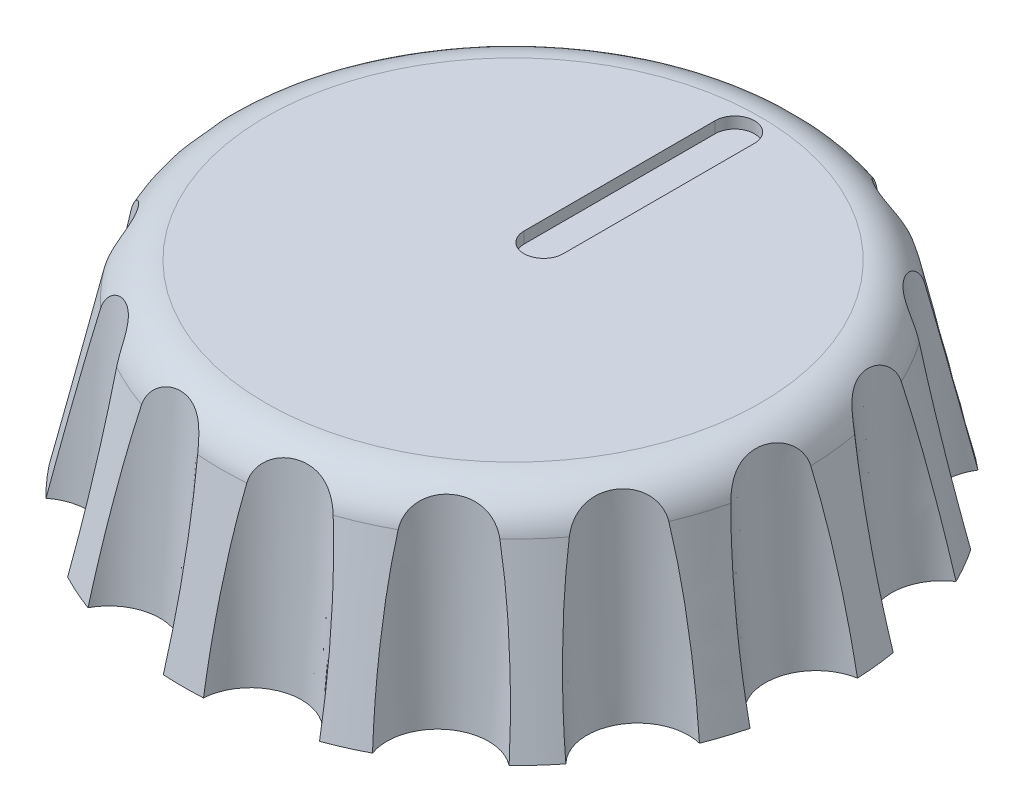
from build123d import *

# Parameters (mm, degrees)
SKETCH1_R                     = 15
BOSS_EXTRUDE1_DEPTH           = 11
SKETCH2_R                     = 2.95
CUT_EXTRUDE1_DEPTH            = 9.8
CUT_EXTRUDE2_DEPTH            = 9.8
CHAMFER1_SIZE                 = 11
CHAMFER1_SIZE_2               = 2.5
FILLET1_R                     = 2
CUT_EXTRUDE6_DEPTH            = 0.5
SKETCH4_R                     = 2.1
CUT_EXTRUDE7_DEPTH            = 11
CUT_EXTRUDE7_DRAFT            = -4
CUT_EXTRUDE7_PROFILE_2_DEPTH  = 11
CUT_EXTRUDE7_PROFILE_2_DRAFT  = -4
CUT_EXTRUDE7_PROFILE_3_DEPTH  = 11
CUT_EXTRUDE7_PROFILE_3_DRAFT  = -4
CUT_EXTRUDE7_PROFILE_4_DEPTH  = 11
CUT_EXTRUDE7_PROFILE_4_DRAFT  = -4
CUT_EXTRUDE7_PROFILE_5_DEPTH  = 11
CUT_EXTRUDE7_PROFILE_5_DRAFT  = -4
CUT_EXTRUDE7_PROFILE_6_DEPTH  = 11
CUT_EXTRUDE7_PROFILE_6_DRAFT  = -4
CUT_EXTRUDE7_PROFILE_7_DEPTH  = 11
CUT_EXTRUDE7_PROFILE_7_DRAFT  = -4
CUT_EXTRUDE7_PROFILE_8_DEPTH  = 11
CUT_EXTRUDE7_PROFILE_8_DRAFT  = -4
CUT_EXTRUDE7_PROFILE_9_DEPTH  = 11
CUT_EXTRUDE7_PROFILE_9_DRAFT  = -4
CUT_EXTRUDE7_PROFILE_10_DEPTH = 11
CUT_EXTRUDE7_PROFILE_10_DRAFT = -4
CUT_EXTRUDE7_PROFILE_11_DEPTH = 11
CUT_EXTRUDE7_PROFILE_11_DRAFT = -4
CUT_EXTRUDE7_PROFILE_12_DEPTH = 11
CUT_EXTRUDE7_PROFILE_12_DRAFT = -4
CUT_EXTRUDE7_PROFILE_13_DEPTH = 11
CUT_EXTRUDE7_PROFILE_13_DRAFT = -4
CUT_EXTRUDE7_PROFILE_14_DEPTH = 11
CUT_EXTRUDE7_PROFILE_14_DRAFT = -4
CUT_EXTRUDE7_PROFILE_15_DEPTH = 11
CUT_EXTRUDE7_PROFILE_15_DRAFT = -4
SKETCH6_W                     = 45.954277426
SKETCH6_H                     = 33.568292674
CUT_EXTRUDE8_DEPTH            = 2


with BuildPart() as part:
    # Sketch1 → Boss-Extrude1 (new body)
    with BuildSketch(Plane(origin=(0, 0, 0), x_dir=(1, 0, 0), z_dir=(0, 1, 0))):
        with Locations(Location((0, 0, 0), (0, 0, 270))):
            Circle(SKETCH1_R)
    extrude(amount=BOSS_EXTRUDE1_DEPTH)

    # Sketch2 → Cut-Extrude1 (cut)
    with BuildSketch(Plane.XZ):
        with Locations(Location((0, 0, 0), (0, 0, 270))):
            Circle(SKETCH2_R)
    extrude(amount=-CUT_EXTRUDE1_DEPTH, mode=Mode.SUBTRACT)

    # Sketch3 → Cut-Extrude2 (cut)
    with BuildSketch(Plane(origin=(0, 0, 0), x_dir=(1, 0, 0), z_dir=(0, 1, 0))):
        Polygon((0.5, 2.883677317), (-0.5, 2.883677317), (0, 3.383677317), align=None)
        Polygon((1.45612204, 2.538760223), (0.516429419, 2.880780367), (1.157285801, 3.179616606), align=None)
        Polygon((2.236614271, 1.887631179), (1.470569828, 2.530418789), (2.174985854, 2.592047206), align=None)
        Polygon((2.747337812, 1.008825956), (2.247337812, 1.87485136), (2.930350514, 1.691838658), align=None)
        Polygon((2.926691867, 0.008341434), (2.75304369, 0.993149188), (3.332271655, 0.5875694), align=None)
        Polygon((2.75304369, -0.993149188), (2.926691867, -0.008341435), (3.332271655, -0.5875694), align=None)
        Polygon((2.247337812, -1.87485136), (2.747337812, -1.008825956), (2.930350514, -1.691838658), align=None)
        Polygon((1.470569828, -2.530418789), (2.236614271, -1.887631179), (2.174985854, -2.592047206), align=None)
        Polygon((0.516429419, -2.880780367), (1.45612204, -2.538760223), (1.157285801, -3.179616606), align=None)
        Polygon((-0.5, -2.883677317), (0.5, -2.883677317), (0, -3.383677317), align=None)
        Polygon((-1.45612204, -2.538760223), (-0.516429419, -2.880780367), (-1.157285801, -3.179616606), align=None)
        Polygon((-2.236614271, -1.887631179), (-1.470569828, -2.530418789), (-2.174985854, -2.592047206), align=None)
        Polygon((-2.747337812, -1.008825956), (-2.247337812, -1.87485136), (-2.930350514, -1.691838658), align=None)
        Polygon((-2.926691867, -0.008341434), (-2.75304369, -0.993149188), (-3.332271655, -0.5875694), align=None)
        Polygon((-2.75304369, 0.993149188), (-2.926691867, 0.008341435), (-3.332271655, 0.5875694), align=None)
        Polygon((-2.247337812, 1.87485136), (-2.747337812, 1.008825956), (-2.930350514, 1.691838658), align=None)
        Polygon((-1.470569828, 2.530418789), (-2.236614271, 1.887631179), (-2.174985854, 2.592047206), align=None)
        Polygon((-0.516429419, 2.880780367), (-1.45612204, 2.538760223), (-1.157285801, 3.179616606), align=None)
    extrude(amount=CUT_EXTRUDE2_DEPTH, mode=Mode.SUBTRACT)

    # Chamfer1
    # the kernel refuses this chamfer: 11, 2.5 mm, written as the material it takes off along each edge
    with BuildSketch(Plane(origin=(0, 11, 0), x_dir=(0, 0, 1), z_dir=(-1, 0, 0))) as chamfer1_piece_1:
        Polygon((15, -CHAMFER1_SIZE), (15 - CHAMFER1_SIZE_2, 0), (15, 0), align=None)
    revolve(axis=Axis((0, 11, 0), (0, 1, 0)), mode=Mode.SUBTRACT)

    # Fillet1
    fillet1_edges = [part.edges().sort_by_distance(p)[0] for p in [
        (0, 11, -12.5),
    ]]
    fillet(fillet1_edges, radius=FILLET1_R)

    # Sketch5 → Cut-Extrude6 (cut)
    with BuildSketch(Plane(origin=(0, 11, 0), x_dir=(1, 0, 0), z_dir=(0, 1, 0))):
        with BuildLine():
            Line((-0.865286108, 1.346377454), (-0.865286108, 9.765172822))
            ThreePointArc((-0.865286108, 9.765172822), (0, 10.63045893), (0.865286108, 9.765172822))
            Line((0.865286108, 9.765172822), (0.865286108, 1.346377454))
            ThreePointArc((0.865286108, 1.346377454), (0, 0.481091346), (-0.865286108, 1.346377454))
        make_face()
    extrude(amount=-CUT_EXTRUDE6_DEPTH, mode=Mode.SUBTRACT)


with BuildPart() as cut_extrude7_tool:
    # Sketch4 → Cut-Extrude7 (with draft: the straight prism first)
    with BuildSketch(Plane(origin=(0, 0, 0), x_dir=(1, 0, 0), z_dir=(0, 1, 0))):
        with Locations((0, 15)):
            Circle(SKETCH4_R)
    extrude(amount=CUT_EXTRUDE7_DEPTH)
    # Cut-Extrude7: the draft: its side faces are tilted about the plane it starts from
    cut_extrude7_sides = [cut_extrude7_tool.faces().sort_by_distance(p)[0] for p in [
        (-2.1, 5.5, -15),
    ]]
    draft(cut_extrude7_sides, Plane(origin=(0, 0, 0), x_dir=(1, 0, 0), z_dir=(0, 1, 0)), CUT_EXTRUDE7_DRAFT)


with BuildPart() as part_1:
    add(part.part)

    # Cut-Extrude7: cut by cut_extrude7_tool
    add(cut_extrude7_tool.part, mode=Mode.SUBTRACT)


with BuildPart() as cut_extrude7_profile_2_tool:
    # Sketch4 → Cut-Extrude7 profile 2 (with draft: the straight prism first)
    with BuildSketch(Plane(origin=(0, 0, 0), x_dir=(1, 0, 0), z_dir=(0, 1, 0))):
        with Locations((6.101049646, 13.703181865)):
            Circle(SKETCH4_R)
    extrude(amount=CUT_EXTRUDE7_PROFILE_2_DEPTH)
    # Cut-Extrude7 profile 2: the draft: its side faces are tilted about the plane it starts from
    cut_extrude7_profile_2_sides = [cut_extrude7_profile_2_tool.faces().sort_by_distance(p)[0] for p in [
        (4.001049646, 5.5, -13.703181865),
    ]]
    draft(cut_extrude7_profile_2_sides, Plane(origin=(0, 0, 0), x_dir=(1, 0, 0), z_dir=(0, 1, 0)), CUT_EXTRUDE7_PROFILE_2_DRAFT)


with BuildPart() as part_2:
    add(part_1.part)

    # Cut-Extrude7 profile 2: cut by cut_extrude7_profile_2_tool
    add(cut_extrude7_profile_2_tool.part, mode=Mode.SUBTRACT)


with BuildPart() as cut_extrude7_profile_3_tool:
    # Sketch4 → Cut-Extrude7 profile 3 (with draft: the straight prism first)
    with BuildSketch(Plane(origin=(0, 0, 0), x_dir=(1, 0, 0), z_dir=(0, 1, 0))):
        with Locations((11.147172382, 10.036959095)):
            Circle(SKETCH4_R)
    extrude(amount=CUT_EXTRUDE7_PROFILE_3_DEPTH)
    # Cut-Extrude7 profile 3: the draft: its side faces are tilted about the plane it starts from
    cut_extrude7_profile_3_sides = [cut_extrude7_profile_3_tool.faces().sort_by_distance(p)[0] for p in [
        (9.047172382, 5.5, -10.036959095),
    ]]
    draft(cut_extrude7_profile_3_sides, Plane(origin=(0, 0, 0), x_dir=(1, 0, 0), z_dir=(0, 1, 0)), CUT_EXTRUDE7_PROFILE_3_DRAFT)


with BuildPart() as part_3:
    add(part_2.part)

    # Cut-Extrude7 profile 3: cut by cut_extrude7_profile_3_tool
    add(cut_extrude7_profile_3_tool.part, mode=Mode.SUBTRACT)


with BuildPart() as cut_extrude7_profile_4_tool:
    # Sketch4 → Cut-Extrude7 profile 4 (with draft: the straight prism first)
    with BuildSketch(Plane(origin=(0, 0, 0), x_dir=(1, 0, 0), z_dir=(0, 1, 0))):
        with Locations((14.265847744, 4.635254916)):
            Circle(SKETCH4_R)
    extrude(amount=CUT_EXTRUDE7_PROFILE_4_DEPTH)
    # Cut-Extrude7 profile 4: the draft: its side faces are tilted about the plane it starts from
    cut_extrude7_profile_4_sides = [cut_extrude7_profile_4_tool.faces().sort_by_distance(p)[0] for p in [
        (12.165847744, 5.5, -4.635254916),
    ]]
    draft(cut_extrude7_profile_4_sides, Plane(origin=(0, 0, 0), x_dir=(1, 0, 0), z_dir=(0, 1, 0)), CUT_EXTRUDE7_PROFILE_4_DRAFT)


with BuildPart() as part_4:
    add(part_3.part)

    # Cut-Extrude7 profile 4: cut by cut_extrude7_profile_4_tool
    add(cut_extrude7_profile_4_tool.part, mode=Mode.SUBTRACT)


with BuildPart() as cut_extrude7_profile_5_tool:
    # Sketch4 → Cut-Extrude7 profile 5 (with draft: the straight prism first)
    with BuildSketch(Plane(origin=(0, 0, 0), x_dir=(1, 0, 0), z_dir=(0, 1, 0))):
        with Locations((14.917828431, -1.567926949)):
            Circle(SKETCH4_R)
    extrude(amount=CUT_EXTRUDE7_PROFILE_5_DEPTH)
    # Cut-Extrude7 profile 5: the draft: its side faces are tilted about the plane it starts from
    cut_extrude7_profile_5_sides = [cut_extrude7_profile_5_tool.faces().sort_by_distance(p)[0] for p in [
        (12.817828431, 5.5, 1.567926949),
    ]]
    draft(cut_extrude7_profile_5_sides, Plane(origin=(0, 0, 0), x_dir=(1, 0, 0), z_dir=(0, 1, 0)), CUT_EXTRUDE7_PROFILE_5_DRAFT)


with BuildPart() as part_5:
    add(part_4.part)

    # Cut-Extrude7 profile 5: cut by cut_extrude7_profile_5_tool
    add(cut_extrude7_profile_5_tool.part, mode=Mode.SUBTRACT)


with BuildPart() as cut_extrude7_profile_6_tool:
    # Sketch4 → Cut-Extrude7 profile 6 (with draft: the straight prism first)
    with BuildSketch(Plane(origin=(0, 0, 0), x_dir=(1, 0, 0), z_dir=(0, 1, 0))):
        with Locations((12.990381057, -7.5)):
            Circle(SKETCH4_R)
    extrude(amount=CUT_EXTRUDE7_PROFILE_6_DEPTH)
    # Cut-Extrude7 profile 6: the draft: its side faces are tilted about the plane it starts from
    cut_extrude7_profile_6_sides = [cut_extrude7_profile_6_tool.faces().sort_by_distance(p)[0] for p in [
        (10.890381057, 5.5, 7.5),
    ]]
    draft(cut_extrude7_profile_6_sides, Plane(origin=(0, 0, 0), x_dir=(1, 0, 0), z_dir=(0, 1, 0)), CUT_EXTRUDE7_PROFILE_6_DRAFT)


with BuildPart() as part_6:
    add(part_5.part)

    # Cut-Extrude7 profile 6: cut by cut_extrude7_profile_6_tool
    add(cut_extrude7_profile_6_tool.part, mode=Mode.SUBTRACT)


with BuildPart() as cut_extrude7_profile_7_tool:
    # Sketch4 → Cut-Extrude7 profile 7 (with draft: the straight prism first)
    with BuildSketch(Plane(origin=(0, 0, 0), x_dir=(1, 0, 0), z_dir=(0, 1, 0))):
        with Locations((8.816778784, -12.135254916)):
            Circle(SKETCH4_R)
    extrude(amount=CUT_EXTRUDE7_PROFILE_7_DEPTH)
    # Cut-Extrude7 profile 7: the draft: its side faces are tilted about the plane it starts from
    cut_extrude7_profile_7_sides = [cut_extrude7_profile_7_tool.faces().sort_by_distance(p)[0] for p in [
        (6.716778784, 5.5, 12.135254916),
    ]]
    draft(cut_extrude7_profile_7_sides, Plane(origin=(0, 0, 0), x_dir=(1, 0, 0), z_dir=(0, 1, 0)), CUT_EXTRUDE7_PROFILE_7_DRAFT)


with BuildPart() as part_7:
    add(part_6.part)

    # Cut-Extrude7 profile 7: cut by cut_extrude7_profile_7_tool
    add(cut_extrude7_profile_7_tool.part, mode=Mode.SUBTRACT)


with BuildPart() as cut_extrude7_profile_8_tool:
    # Sketch4 → Cut-Extrude7 profile 8 (with draft: the straight prism first)
    with BuildSketch(Plane(origin=(0, 0, 0), x_dir=(1, 0, 0), z_dir=(0, 1, 0))):
        with Locations((3.118675362, -14.672214011)):
            Circle(SKETCH4_R)
    extrude(amount=CUT_EXTRUDE7_PROFILE_8_DEPTH)
    # Cut-Extrude7 profile 8: the draft: its side faces are tilted about the plane it starts from
    cut_extrude7_profile_8_sides = [cut_extrude7_profile_8_tool.faces().sort_by_distance(p)[0] for p in [
        (1.018675362, 5.5, 14.672214011),
    ]]
    draft(cut_extrude7_profile_8_sides, Plane(origin=(0, 0, 0), x_dir=(1, 0, 0), z_dir=(0, 1, 0)), CUT_EXTRUDE7_PROFILE_8_DRAFT)


with BuildPart() as part_8:
    add(part_7.part)

    # Cut-Extrude7 profile 8: cut by cut_extrude7_profile_8_tool
    add(cut_extrude7_profile_8_tool.part, mode=Mode.SUBTRACT)


with BuildPart() as cut_extrude7_profile_9_tool:
    # Sketch4 → Cut-Extrude7 profile 9 (with draft: the straight prism first)
    with BuildSketch(Plane(origin=(0, 0, 0), x_dir=(1, 0, 0), z_dir=(0, 1, 0))):
        with Locations((-3.118675362, -14.672214011)):
            Circle(SKETCH4_R)
    extrude(amount=CUT_EXTRUDE7_PROFILE_9_DEPTH)
    # Cut-Extrude7 profile 9: the draft: its side faces are tilted about the plane it starts from
    cut_extrude7_profile_9_sides = [cut_extrude7_profile_9_tool.faces().sort_by_distance(p)[0] for p in [
        (-5.218675362, 5.5, 14.672214011),
    ]]
    draft(cut_extrude7_profile_9_sides, Plane(origin=(0, 0, 0), x_dir=(1, 0, 0), z_dir=(0, 1, 0)), CUT_EXTRUDE7_PROFILE_9_DRAFT)


with BuildPart() as part_9:
    add(part_8.part)

    # Cut-Extrude7 profile 9: cut by cut_extrude7_profile_9_tool
    add(cut_extrude7_profile_9_tool.part, mode=Mode.SUBTRACT)


with BuildPart() as cut_extrude7_profile_10_tool:
    # Sketch4 → Cut-Extrude7 profile 10 (with draft: the straight prism first)
    with BuildSketch(Plane(origin=(0, 0, 0), x_dir=(1, 0, 0), z_dir=(0, 1, 0))):
        with Locations((-8.816778784, -12.135254916)):
            Circle(SKETCH4_R)
    extrude(amount=CUT_EXTRUDE7_PROFILE_10_DEPTH)
    # Cut-Extrude7 profile 10: the draft: its side faces are tilted about the plane it starts from
    cut_extrude7_profile_10_sides = [cut_extrude7_profile_10_tool.faces().sort_by_distance(p)[0] for p in [
        (-10.916778784, 5.5, 12.135254916),
    ]]
    draft(cut_extrude7_profile_10_sides, Plane(origin=(0, 0, 0), x_dir=(1, 0, 0), z_dir=(0, 1, 0)), CUT_EXTRUDE7_PROFILE_10_DRAFT)


with BuildPart() as part_10:
    add(part_9.part)

    # Cut-Extrude7 profile 10: cut by cut_extrude7_profile_10_tool
    add(cut_extrude7_profile_10_tool.part, mode=Mode.SUBTRACT)


with BuildPart() as cut_extrude7_profile_11_tool:
    # Sketch4 → Cut-Extrude7 profile 11 (with draft: the straight prism first)
    with BuildSketch(Plane(origin=(0, 0, 0), x_dir=(1, 0, 0), z_dir=(0, 1, 0))):
        with Locations((-12.990381057, -7.5)):
            Circle(SKETCH4_R)
    extrude(amount=CUT_EXTRUDE7_PROFILE_11_DEPTH)
    # Cut-Extrude7 profile 11: the draft: its side faces are tilted about the plane it starts from
    cut_extrude7_profile_11_sides = [cut_extrude7_profile_11_tool.faces().sort_by_distance(p)[0] for p in [
        (-15.090381057, 5.5, 7.5),
    ]]
    draft(cut_extrude7_profile_11_sides, Plane(origin=(0, 0, 0), x_dir=(1, 0, 0), z_dir=(0, 1, 0)), CUT_EXTRUDE7_PROFILE_11_DRAFT)


with BuildPart() as part_11:
    add(part_10.part)

    # Cut-Extrude7 profile 11: cut by cut_extrude7_profile_11_tool
    add(cut_extrude7_profile_11_tool.part, mode=Mode.SUBTRACT)


with BuildPart() as cut_extrude7_profile_12_tool:
    # Sketch4 → Cut-Extrude7 profile 12 (with draft: the straight prism first)
    with BuildSketch(Plane(origin=(0, 0, 0), x_dir=(1, 0, 0), z_dir=(0, 1, 0))):
        with Locations((-14.917828431, -1.567926949)):
            Circle(SKETCH4_R)
    extrude(amount=CUT_EXTRUDE7_PROFILE_12_DEPTH)
    # Cut-Extrude7 profile 12: the draft: its side faces are tilted about the plane it starts from
    cut_extrude7_profile_12_sides = [cut_extrude7_profile_12_tool.faces().sort_by_distance(p)[0] for p in [
        (-17.017828431, 5.5, 1.567926949),
    ]]
    draft(cut_extrude7_profile_12_sides, Plane(origin=(0, 0, 0), x_dir=(1, 0, 0), z_dir=(0, 1, 0)), CUT_EXTRUDE7_PROFILE_12_DRAFT)


with BuildPart() as part_12:
    add(part_11.part)

    # Cut-Extrude7 profile 12: cut by cut_extrude7_profile_12_tool
    add(cut_extrude7_profile_12_tool.part, mode=Mode.SUBTRACT)


with BuildPart() as cut_extrude7_profile_13_tool:
    # Sketch4 → Cut-Extrude7 profile 13 (with draft: the straight prism first)
    with BuildSketch(Plane(origin=(0, 0, 0), x_dir=(1, 0, 0), z_dir=(0, 1, 0))):
        with Locations((-14.265847744, 4.635254916)):
            Circle(SKETCH4_R)
    extrude(amount=CUT_EXTRUDE7_PROFILE_13_DEPTH)
    # Cut-Extrude7 profile 13: the draft: its side faces are tilted about the plane it starts from
    cut_extrude7_profile_13_sides = [cut_extrude7_profile_13_tool.faces().sort_by_distance(p)[0] for p in [
        (-16.365847744, 5.5, -4.635254916),
    ]]
    draft(cut_extrude7_profile_13_sides, Plane(origin=(0, 0, 0), x_dir=(1, 0, 0), z_dir=(0, 1, 0)), CUT_EXTRUDE7_PROFILE_13_DRAFT)


with BuildPart() as part_13:
    add(part_12.part)

    # Cut-Extrude7 profile 13: cut by cut_extrude7_profile_13_tool
    add(cut_extrude7_profile_13_tool.part, mode=Mode.SUBTRACT)


with BuildPart() as cut_extrude7_profile_14_tool:
    # Sketch4 → Cut-Extrude7 profile 14 (with draft: the straight prism first)
    with BuildSketch(Plane(origin=(0, 0, 0), x_dir=(1, 0, 0), z_dir=(0, 1, 0))):
        with Locations((-11.147172382, 10.036959095)):
            Circle(SKETCH4_R)
    extrude(amount=CUT_EXTRUDE7_PROFILE_14_DEPTH)
    # Cut-Extrude7 profile 14: the draft: its side faces are tilted about the plane it starts from
    cut_extrude7_profile_14_sides = [cut_extrude7_profile_14_tool.faces().sort_by_distance(p)[0] for p in [
        (-13.247172382, 5.5, -10.036959095),
    ]]
    draft(cut_extrude7_profile_14_sides, Plane(origin=(0, 0, 0), x_dir=(1, 0, 0), z_dir=(0, 1, 0)), CUT_EXTRUDE7_PROFILE_14_DRAFT)


with BuildPart() as part_14:
    add(part_13.part)

    # Cut-Extrude7 profile 14: cut by cut_extrude7_profile_14_tool
    add(cut_extrude7_profile_14_tool.part, mode=Mode.SUBTRACT)


with BuildPart() as cut_extrude7_profile_15_tool:
    # Sketch4 → Cut-Extrude7 profile 15 (with draft: the straight prism first)
    with BuildSketch(Plane(origin=(0, 0, 0), x_dir=(1, 0, 0), z_dir=(0, 1, 0))):
        with Locations((-6.101049646, 13.703181865)):
            Circle(SKETCH4_R)
    extrude(amount=CUT_EXTRUDE7_PROFILE_15_DEPTH)
    # Cut-Extrude7 profile 15: the draft: its side faces are tilted about the plane it starts from
    cut_extrude7_profile_15_sides = [cut_extrude7_profile_15_tool.faces().sort_by_distance(p)[0] for p in [
        (-8.201049646, 5.5, -13.703181865),
    ]]
    draft(cut_extrude7_profile_15_sides, Plane(origin=(0, 0, 0), x_dir=(1, 0, 0), z_dir=(0, 1, 0)), CUT_EXTRUDE7_PROFILE_15_DRAFT)


with BuildPart() as part_15:
    add(part_14.part)

    # Cut-Extrude7 profile 15: cut by cut_extrude7_profile_15_tool
    add(cut_extrude7_profile_15_tool.part, mode=Mode.SUBTRACT)

    # Sketch6 → Cut-Extrude8 (cut)
    with BuildSketch(Plane.XZ):
        Rectangle(SKETCH6_W, SKETCH6_H)
    extrude(amount=-CUT_EXTRUDE8_DEPTH, mode=Mode.SUBTRACT)


solid = part_15.part
